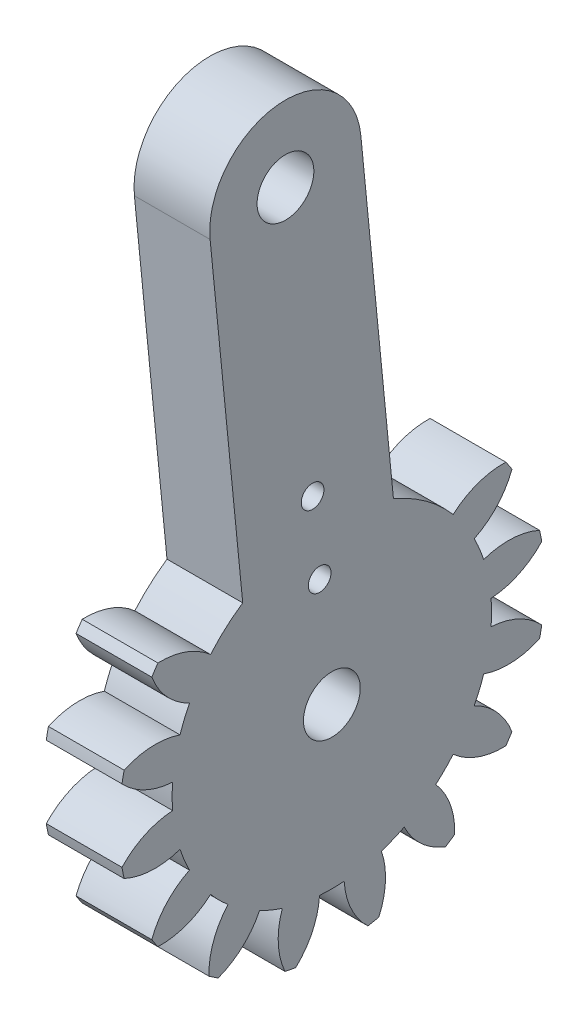
from build123d import *

# Parameters (mm, degrees)
SPUR_START             = 18.857514679
SPUR_GEAR_GB_OUTLINE_R = 1.5
SPUR_GEAR_GB_DEPTH     = 4
CUT_EXTRUDE_START      = -10
CUT_EXTRUDE_1_DEPTH    = 10
EXTRUDE_START          = -4
SKETCH_3_R             = 1.5
EXTRUDE_1_DEPTH        = 4
SKETCH_5_R             = 0.6
CUT_EXTRUDE_2_DEPTH    = 10


# Read off the part's stored shape, not the designer's step: spur gear_gb
with BuildPart() as part:
    # spur gear_gb outline → spur gear_gb (new body)
    with BuildSketch(Plane.YZ.offset(SPUR_START)):
        with BuildLine():
            ThreePointArc((-2.124081285, 2.218549628), (-2.409806694, 2.279250398), (-2.69701173, 2.332512579))
            ThreePointArc((-2.69701173, 2.332512579), (-3.581509704, 1.114965359), (-3.953511283, -0.34324338))
            ThreePointArc((-3.953511283, -0.34324338), (-4.604572817, -0.318084007), (-5.25563435, -0.34324338))
            ThreePointArc((-5.25563435, -0.34324338), (-5.627635929, 1.114965359), (-6.512133903, 2.332512579))
            ThreePointArc((-6.512133903, 2.332512579), (-6.799338939, 2.279250398), (-7.085064348, 2.218549628))
            ThreePointArc((-7.085064348, 2.218549628), (-7.436298774, 0.75519995), (-7.221951093, -0.734368099))
            ThreePointArc((-7.221951093, -0.734368099), (-7.833081593, -0.960274331), (-8.424955943, -1.232669023))
            ThreePointArc((-8.424955943, -1.232669023), (-9.326672913, -0.027818656), (-10.609777638, 0.75856558))
            ThreePointArc((-10.609777638, 0.75856558), (-10.854737938, 0.599449132), (-11.095484616, 0.434026553))
            ThreePointArc((-11.095484616, 0.434026553), (-10.859983236, -1.052343859), (-10.091918787, -2.346497986))
            ThreePointArc((-10.091918787, -2.346497986), (-10.570079176, -2.789077647), (-11.012658837, -3.267238036))
            ThreePointArc((-11.012658837, -3.267238036), (-12.306812964, -2.499173587), (-13.793183376, -2.263672207))
            ThreePointArc((-13.793183376, -2.263672207), (-13.958605955, -2.504418885), (-14.117722403, -2.749379185))
            ThreePointArc((-14.117722403, -2.749379185), (-13.331338167, -4.03248391), (-12.1264878, -4.93420088))
            ThreePointArc((-12.1264878, -4.93420088), (-12.398882492, -5.52607523), (-12.624788724, -6.13720573))
            ThreePointArc((-12.624788724, -6.13720573), (-14.114356773, -5.922858049), (-15.577706451, -6.274092475))
            ThreePointArc((-15.577706451, -6.274092475), (-15.638407221, -6.559817884), (-15.691669402, -6.84702292))
            ThreePointArc((-15.691669402, -6.84702292), (-14.474122182, -7.731520894), (-13.015913443, -8.103522473))
            ThreePointArc((-13.015913443, -8.103522473), (-13.041072816, -8.754584007), (-13.015913443, -9.40564554))
            ThreePointArc((-13.015913443, -9.40564554), (-14.474122182, -9.777647119), (-15.691669402, -10.662145093))
            ThreePointArc((-15.691669402, -10.662145093), (-15.638407221, -10.949350129), (-15.577706451, -11.235075538))
            ThreePointArc((-15.577706451, -11.235075538), (-14.114356773, -11.586309964), (-12.624788724, -11.371962283))
            ThreePointArc((-12.624788724, -11.371962283), (-12.398882492, -11.983092783), (-12.1264878, -12.574967133))
            ThreePointArc((-12.1264878, -12.574967133), (-13.331338167, -13.476684103), (-14.117722403, -14.759788828))
            ThreePointArc((-14.117722403, -14.759788828), (-13.958605955, -15.004749128), (-13.793183376, -15.245495806))
            ThreePointArc((-13.793183376, -15.245495806), (-12.306812964, -15.009994426), (-11.012658837, -14.241929977))
            ThreePointArc((-11.012658837, -14.241929977), (-10.570079176, -14.720090366), (-10.091918787, -15.162670027))
            ThreePointArc((-10.091918787, -15.162670027), (-10.859983236, -16.456824154), (-11.095484616, -17.943194566))
            ThreePointArc((-11.095484616, -17.943194566), (-10.854737938, -18.108617145), (-10.609777638, -18.267733593))
            ThreePointArc((-10.609777638, -18.267733593), (-9.326672913, -17.481349357), (-8.424955943, -16.27649899))
            ThreePointArc((-8.424955943, -16.27649899), (-7.833081594, -16.548893683), (-7.221951093, -16.774799914))
            ThreePointArc((-7.221951093, -16.774799914), (-7.436298774, -18.264367963), (-7.085064348, -19.727717641))
            ThreePointArc((-7.085064348, -19.727717641), (-6.799338939, -19.788418411), (-6.512133903, -19.841680592))
            ThreePointArc((-6.512133903, -19.841680592), (-5.627635929, -18.624133372), (-5.25563435, -17.165924633))
            ThreePointArc((-5.25563435, -17.165924633), (-4.604572817, -17.191084007), (-3.953511283, -17.165924633))
            ThreePointArc((-3.953511283, -17.165924633), (-3.581509704, -18.624133372), (-2.69701173, -19.841680592))
            ThreePointArc((-2.69701173, -19.841680592), (-2.409806694, -19.788418411), (-2.124081285, -19.727717641))
            ThreePointArc((-2.124081285, -19.727717641), (-1.772846859, -18.264367963), (-1.98719454, -16.774799914))
            ThreePointArc((-1.98719454, -16.774799914), (-1.376064039, -16.548893683), (-0.78418969, -16.27649899))
            ThreePointArc((-0.78418969, -16.27649899), (0.11752728, -17.481349357), (1.400632005, -18.267733593))
            ThreePointArc((1.400632005, -18.267733593), (1.645592305, -18.108617145), (1.886338983, -17.943194566))
            ThreePointArc((1.886338983, -17.943194566), (1.650837603, -16.456824154), (0.882773154, -15.162670027))
            ThreePointArc((0.882773154, -15.162670027), (1.360933543, -14.720090366), (1.803513204, -14.241929977))
            ThreePointArc((1.803513204, -14.241929977), (3.097667331, -15.009994426), (4.584037743, -15.245495806))
            ThreePointArc((4.584037743, -15.245495806), (4.749460322, -15.004749128), (4.90857677, -14.759788828))
            ThreePointArc((4.90857677, -14.759788828), (4.122192534, -13.476684103), (2.917342167, -12.574967133))
            ThreePointArc((2.917342167, -12.574967133), (3.18973686, -11.983092784), (3.415643091, -11.371962283))
            ThreePointArc((3.415643091, -11.371962283), (4.90521114, -11.586309964), (6.368560818, -11.235075538))
            ThreePointArc((6.368560818, -11.235075538), (6.429261588, -10.949350129), (6.482523769, -10.662145093))
            ThreePointArc((6.482523769, -10.662145093), (5.264976549, -9.777647119), (3.80676781, -9.40564554))
            ThreePointArc((3.80676781, -9.40564554), (3.831927184, -8.754584007), (3.80676781, -8.103522473))
            ThreePointArc((3.80676781, -8.103522473), (5.264976549, -7.731520894), (6.482523769, -6.84702292))
            ThreePointArc((6.482523769, -6.84702292), (6.429261588, -6.559817884), (6.368560818, -6.274092475))
            ThreePointArc((6.368560818, -6.274092475), (4.90521114, -5.922858049), (3.415643091, -6.13720573))
            ThreePointArc((3.415643091, -6.13720573), (3.18973686, -5.526075229), (2.917342167, -4.93420088))
            ThreePointArc((2.917342167, -4.93420088), (4.122192534, -4.03248391), (4.90857677, -2.749379185))
            ThreePointArc((4.90857677, -2.749379185), (4.749460322, -2.504418885), (4.584037743, -2.263672207))
            ThreePointArc((4.584037743, -2.263672207), (3.097667331, -2.499173587), (1.803513204, -3.267238036))
            ThreePointArc((1.803513204, -3.267238036), (1.360933543, -2.789077647), (0.882773154, -2.346497986))
            ThreePointArc((0.882773154, -2.346497986), (1.650837603, -1.052343859), (1.886338983, 0.434026553))
            ThreePointArc((1.886338983, 0.434026553), (1.645592305, 0.599449132), (1.400632005, 0.75856558))
            ThreePointArc((1.400632005, 0.75856558), (0.11752728, -0.027818656), (-0.78418969, -1.232669023))
            ThreePointArc((-0.78418969, -1.232669023), (-1.37606404, -0.960274331), (-1.98719454, -0.734368099))
            ThreePointArc((-1.98719454, -0.734368099), (-1.772846859, 0.75519995), (-2.124081285, 2.218549628))
        make_face()
        with Locations((-4.604572816, -8.754584007)):
            Circle(SPUR_GEAR_GB_OUTLINE_R, mode=Mode.SUBTRACT)
    extrude(amount=SPUR_GEAR_GB_DEPTH)

    # 草图2 → 切除-拉伸1 (cut)
    with BuildSketch(Plane(origin=(22.857514679, 0, 0), x_dir=(0, 0, -1), z_dir=(1, 0, 0)).offset(CUT_EXTRUDE_START)):
        with BuildLine():
            ThreePointArc((14.241929977, 1.803513204), (13.441652277, 2.410120568), (12.574967133, 2.917342167))
            ThreePointArc((12.574967133, 2.917342167), (13.476684103, 4.122192534), (14.759788828, 4.90857677))
            ThreePointArc((14.759788828, 4.90857677), (15.004749128, 4.749460322), (15.245495806, 4.584037743))
            ThreePointArc((15.245495806, 4.584037743), (15.009994426, 3.097667331), (14.241929977, 1.803513204))
        make_face()
        with BuildLine():
            ThreePointArc((11.371962283, 3.415643091), (11.586309964, 4.905211141), (11.235075538, 6.368560818))
            ThreePointArc((11.235075538, 6.368560818), (10.949350129, 6.429261588), (10.662145093, 6.482523769))
            ThreePointArc((10.662145093, 6.482523769), (9.777647119, 5.264976549), (9.40564554, 3.80676781))
            ThreePointArc((9.40564554, 3.80676781), (10.400463508, 3.669822202), (11.371962283, 3.415643091))
        make_face()
        with BuildLine():
            ThreePointArc((8.103522473, 3.80676781), (7.731520894, 5.264976549), (6.84702292, 6.482523769))
            ThreePointArc((6.84702292, 6.482523769), (6.559817884, 6.429261588), (6.274092475, 6.368560818))
            ThreePointArc((6.274092475, 6.368560818), (5.922858049, 4.905211141), (6.13720573, 3.415643091))
            ThreePointArc((6.13720573, 3.415643091), (7.108704505, 3.669822202), (8.103522473, 3.80676781))
        make_face()
        with BuildLine():
            ThreePointArc((4.93420088, 2.917342167), (4.03248391, 4.122192534), (2.749379185, 4.90857677))
            ThreePointArc((2.749379185, 4.90857677), (2.504418885, 4.749460322), (2.263672207, 4.584037743))
            ThreePointArc((2.263672207, 4.584037743), (2.499173587, 3.097667331), (3.267238036, 1.803513204))
            ThreePointArc((3.267238036, 1.803513204), (4.067515736, 2.410120568), (4.93420088, 2.917342167))
        make_face()
    extrude(amount=CUT_EXTRUDE_1_DEPTH, mode=Mode.SUBTRACT)

    # 草图3 → 凸台-拉伸1 (add)
    with BuildSketch(Plane(origin=(22.857514679, 0, 0), x_dir=(0, 0, -1), z_dir=(1, 0, 0)).offset(EXTRUDE_START)):
        with BuildLine():
            Line((2.323416592, 19.882976789), (4.7738451, -4.996641378))
            ThreePointArc((4.7738451, -4.996641378), (9.146652568, -8.585311723), (12.735322913, -4.212504255))
            Line((12.735322913, -4.212504255), (10.284894405, 20.667113912))
            ThreePointArc((10.284894405, 20.667113912), (5.912086937, 24.255784257), (2.323416592, 19.882976789))
        make_face()
        with Locations((6.304155498, 20.27504535)):
            Circle(SKETCH_3_R, mode=Mode.SUBTRACT)
        with Locations(Location((8.754584007, -4.604572816, 0), (0, 0, 180))):
            Circle(SKETCH_3_R, mode=Mode.SUBTRACT)
    extrude(amount=EXTRUDE_1_DEPTH)

    # 草图5 → 切除-拉伸2 (cut)
    with BuildSketch(Plane(origin=(22.857514679, 0, 0), x_dir=(0, 0, -1), z_dir=(1, 0, 0))):
        with Locations((8.109420565, 1.446128724)):
            Circle(SKETCH_5_R)
        with Locations((7.737682597, 5.429027561)):
            Circle(SKETCH_5_R)
    extrude(amount=-CUT_EXTRUDE_2_DEPTH, mode=Mode.SUBTRACT)


solid = part.part
